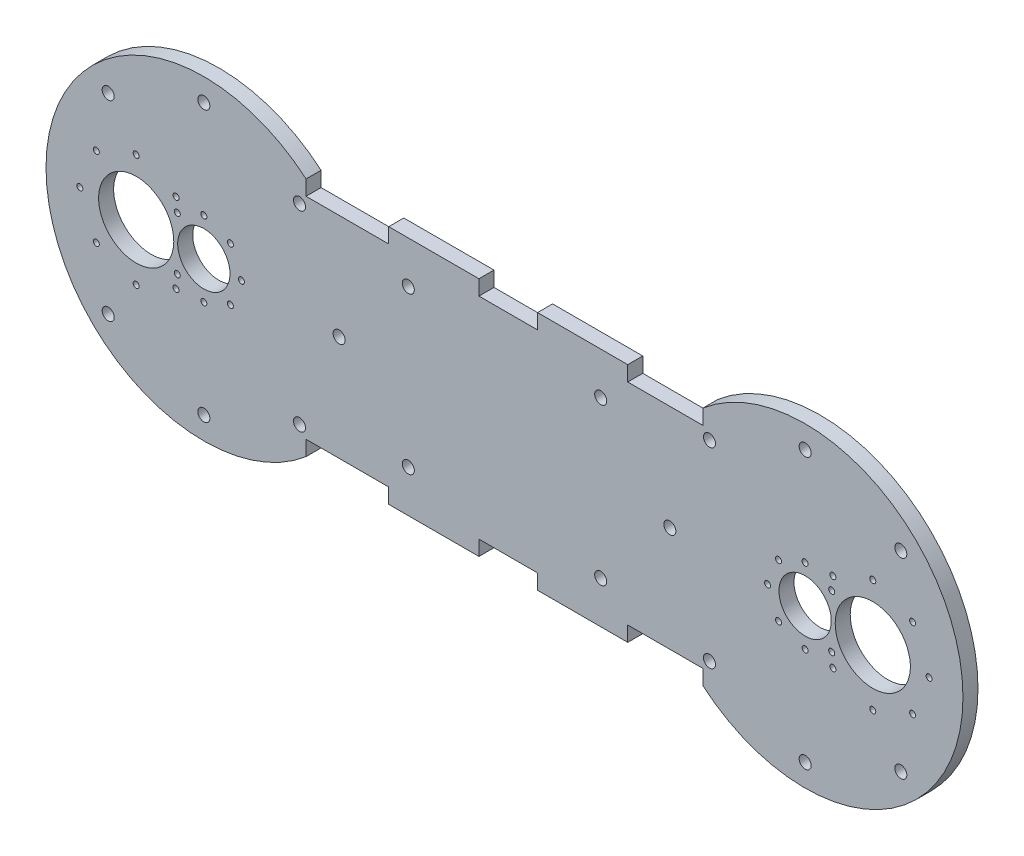
from build123d import *

# Parameters (mm, degrees)
SKETCH1_R           = 3.175
SKETCH1_R_2         = 2.54
BOSS_EXTRUDE1_DEPTH = 3.175
SKETCH2_R           = 11.049
SKETCH2_R_2         = 15.875
SKETCH2_R_3         = 1.27
CUT_EXTRUDE1_DEPTH  = 205.928972451
SKETCH3_R           = 2.54
CUT_EXTRUDE2_DEPTH  = 205.928972451
SKETCH4_W           = 34.925
SKETCH4_H           = 6.35
SKETCH4_W_2         = 24.75566227
SKETCH4_W_3         = 31.75
CUT_EXTRUDE3_DEPTH  = 205.928972451


with BuildPart() as part:
    # Sketch1 → Boss-Extrude1 (new, symmetric)
    with BuildSketch(Plane.XY):
        with BuildLine():
            Line((-83.815331135, 50.8), (83.815331135, 50.8))
            ThreePointArc((83.815331135, 50.8), (193.675, 0), (83.815331135, -50.8))
            Line((83.815331135, -50.8), (-83.815331135, -50.8))
            ThreePointArc((-83.815331135, -50.8), (-193.675, 0), (-83.815331135, 50.8))
        make_face()
        with Locations((-127, 0)):
            Circle(SKETCH1_R, mode=Mode.SUBTRACT)
        with Locations((127, 0)):
            Circle(SKETCH1_R, mode=Mode.SUBTRACT)
        with Locations((-127, 57.15)):
            Circle(SKETCH1_R_2, mode=Mode.SUBTRACT)
        with Locations((-86.588847455, 40.411152545)):
            Circle(SKETCH1_R_2, mode=Mode.SUBTRACT)
        with Locations((-69.85, 0)):
            Circle(SKETCH1_R_2, mode=Mode.SUBTRACT)
        with Locations((-86.588847455, -40.411152545)):
            Circle(SKETCH1_R_2, mode=Mode.SUBTRACT)
        with Locations((-127, -57.15)):
            Circle(SKETCH1_R_2, mode=Mode.SUBTRACT)
        with Locations((-167.411152545, -40.411152545)):
            Circle(SKETCH1_R_2, mode=Mode.SUBTRACT)
        with Locations((-167.411152545, 40.411152545)):
            Circle(SKETCH1_R_2, mode=Mode.SUBTRACT)
        with Locations((127, 57.15)):
            Circle(SKETCH1_R_2, mode=Mode.SUBTRACT)
        with Locations((167.411152545, 40.411152545)):
            Circle(SKETCH1_R_2, mode=Mode.SUBTRACT)
        with Locations((167.411152545, -40.411152545)):
            Circle(SKETCH1_R_2, mode=Mode.SUBTRACT)
        with Locations((127, -57.15)):
            Circle(SKETCH1_R_2, mode=Mode.SUBTRACT)
        with Locations((86.588847455, -40.411152545)):
            Circle(SKETCH1_R_2, mode=Mode.SUBTRACT)
        with Locations((69.85, 0)):
            Circle(SKETCH1_R_2, mode=Mode.SUBTRACT)
        with Locations((86.588847455, 40.411152545)):
            Circle(SKETCH1_R_2, mode=Mode.SUBTRACT)
    extrude(amount=BOSS_EXTRUDE1_DEPTH, both=True)

    # Sketch2 → Cut-Extrude1 (cut, through all)
    with BuildSketch(Plane.XY.offset(3.175)):
        with Locations((-127, 0)):
            Circle(SKETCH2_R)
        with Locations((-155.575, 0)):
            Circle(SKETCH2_R_2)
        with Locations((-155.575, 23.8125)):
            Circle(SKETCH2_R_3)
        with Locations((-138.737019773, 16.837980227)):
            Circle(SKETCH2_R_3)
        with Locations((-138.737019773, -16.837980227)):
            Circle(SKETCH2_R_3)
        with Locations((-155.575, -23.8125)):
            Circle(SKETCH2_R_3)
        with Locations((-172.412980227, -16.837980227)):
            Circle(SKETCH2_R_3)
        with Locations((-179.3875, 0)):
            Circle(SKETCH2_R_3)
        with Locations((-172.412980227, 16.837980227)):
            Circle(SKETCH2_R_3)
        with Locations((-127, 15.875)):
            Circle(SKETCH2_R_3)
        with Locations((-115.774679849, 11.225320151)):
            Circle(SKETCH2_R_3)
        with Locations((-111.125, 0)):
            Circle(SKETCH2_R_3)
        with Locations((-115.774679849, -11.225320151)):
            Circle(SKETCH2_R_3)
        with Locations((-127, -15.875)):
            Circle(SKETCH2_R_3)
        with Locations((-138.225320151, -11.225320151)):
            Circle(SKETCH2_R_3)
        with Locations((138.225320151, 11.225320151)):
            Circle(SKETCH2_R_3)
        with Locations((-138.225320151, 11.225320151)):
            Circle(SKETCH2_R_3)
        with Locations((138.225320151, -11.225320151)):
            Circle(SKETCH2_R_3)
        with Locations((127, -15.875)):
            Circle(SKETCH2_R_3)
        with Locations((115.774679849, -11.225320151)):
            Circle(SKETCH2_R_3)
        with Locations((111.125, 0)):
            Circle(SKETCH2_R_3)
        with Locations((115.774679849, 11.225320151)):
            Circle(SKETCH2_R_3)
        with Locations((127, 15.875)):
            Circle(SKETCH2_R_3)
        with Locations((172.412980227, 16.837980227)):
            Circle(SKETCH2_R_3)
        with Locations((179.3875, 0)):
            Circle(SKETCH2_R_3)
        with Locations((172.412980227, -16.837980227)):
            Circle(SKETCH2_R_3)
        with Locations((155.575, -23.8125)):
            Circle(SKETCH2_R_3)
        with Locations((138.737019773, -16.837980227)):
            Circle(SKETCH2_R_3)
        with Locations((138.737019773, 16.837980227)):
            Circle(SKETCH2_R_3)
        with Locations((155.575, 23.8125)):
            Circle(SKETCH2_R_3)
        with Locations((155.575, 0)):
            Circle(SKETCH2_R_2)
        with Locations((127, 0)):
            Circle(SKETCH2_R)
    extrude(amount=-CUT_EXTRUDE1_DEPTH, mode=Mode.SUBTRACT)

    # Sketch3 → Cut-Extrude2 (cut, through all)
    with BuildSketch(Plane.XY.offset(3.175)):
        with Locations((-40.64, 33.02)):
            Circle(SKETCH3_R)
        with Locations((40.64, 33.02)):
            Circle(SKETCH3_R)
        with Locations((40.64, -33.02)):
            Circle(SKETCH3_R)
        with Locations((-40.64, -33.02)):
            Circle(SKETCH3_R)
    extrude(amount=-CUT_EXTRUDE2_DEPTH, mode=Mode.SUBTRACT)

    # Sketch4 → Cut-Extrude3 (cut, through all)
    with BuildSketch(Plane.XY.offset(3.175)):
        with Locations((-66.352831135, 47.625)):
            Rectangle(SKETCH4_W, SKETCH4_H)
        with Locations((1.5875, 47.625)):
            Rectangle(SKETCH4_W_2, SKETCH4_H)
        with Locations((67.940331135, 47.625)):
            Rectangle(SKETCH4_W_3, SKETCH4_H)
        with Locations((67.940331135, -47.625)):
            Rectangle(SKETCH4_W_3, SKETCH4_H)
        with Locations((1.5875, -47.625)):
            Rectangle(SKETCH4_W_2, SKETCH4_H)
        with Locations((-66.352831135, -47.625)):
            Rectangle(SKETCH4_W, SKETCH4_H)
    extrude(amount=-CUT_EXTRUDE3_DEPTH, mode=Mode.SUBTRACT)


solid = part.part
